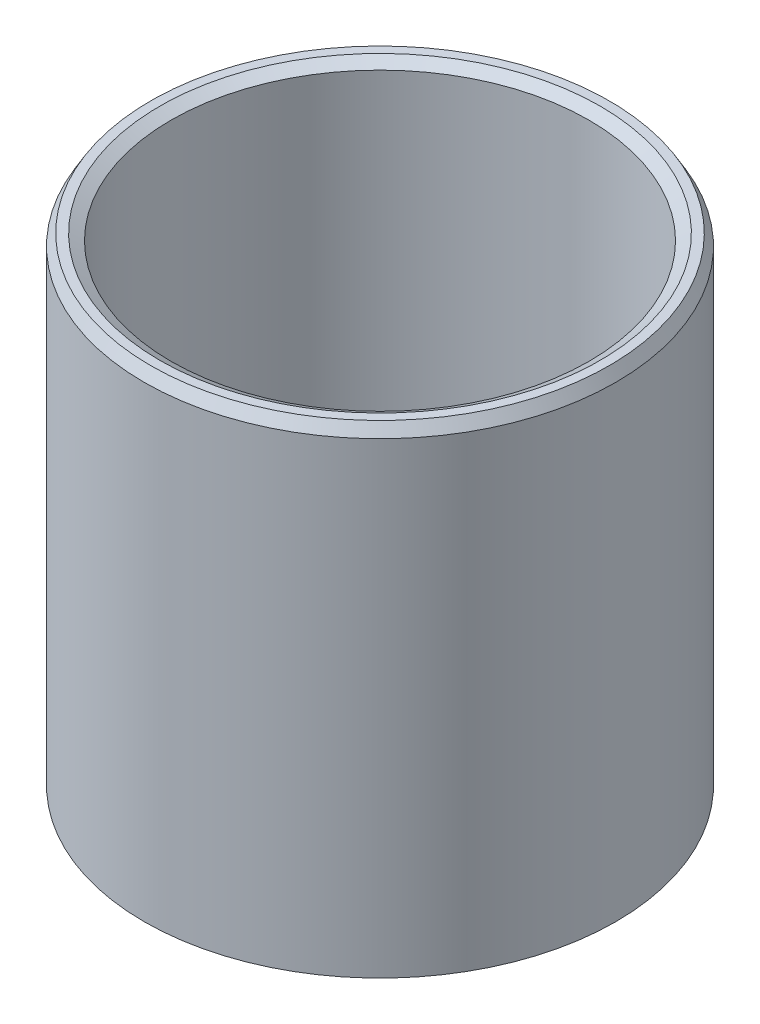
from build123d import *
from OCP.BRepFilletAPI import BRepFilletAPI_MakeChamfer

# Parameters (mm, degrees)
SKETCH1_R           = 42.5
BOSS_EXTRUDE1_DEPTH = 87.382263696
SKETCH2_R           = 37.662144637
CUT_EXTRUDE1_DEPTH  = 107.057343021
CHAMFER1_SIZE       = 2.025331092
CHAMFER1_SIZE2      = 1.169325451


with BuildPart() as part:
    # Sketch1 → Boss-Extrude1 (new body)
    with BuildSketch(Plane(origin=(0, 0, 0), x_dir=(1, 0, 0), z_dir=(0, 1, 0))):
        Circle(SKETCH1_R)
    extrude(amount=BOSS_EXTRUDE1_DEPTH)

    # Sketch2 → Cut-Extrude1 (cut, through all)
    with BuildSketch(Plane(origin=(0, 0, 0), x_dir=(1, 0, 0), z_dir=(0, 1, 0))):
        Circle(SKETCH2_R)
    extrude(amount=CUT_EXTRUDE1_DEPTH, mode=Mode.SUBTRACT)

    # Chamfer1: one chamfer whose edges measure the first distance from different faces: ONE call of the kernel's chamfer builder (chamfer() names one face for all edges)
    chamfer1_edges_1 = [part.edges().sort_by_distance(p)[0] for p in [
        (-37.662144637, 87.382263696, 0),
    ]]
    chamfer1_side_1 = [part.faces().sort_by_distance(p)[0] for p in [
        (-41.297918472, 87.382263696, 0),
    ]]
    chamfer1_edges_2 = [part.edges().sort_by_distance(p)[0] for p in [
        (-37.662144637, 0, 0),
    ]]
    chamfer1_side_2 = [part.faces().sort_by_distance(p)[0] for p in [
        (-37.662144637, 43.691131848, 0),
    ]]
    chamfer1_edges_3 = [part.edges().sort_by_distance(p)[0] for p in [
        (-42.5, 0, 0),
    ]]
    chamfer1_side_3 = [part.faces().sort_by_distance(p)[0] for p in [
        (-41.297918472, 0, 0),
    ]]
    chamfer1_edges_4 = [part.edges().sort_by_distance(p)[0] for p in [
        (-42.5, 87.382263696, 0),
    ]]
    chamfer1_side_4 = [part.faces().sort_by_distance(p)[0] for p in [
        (-42.5, 43.691131848, 0),
    ]]
    chamfer1 = BRepFilletAPI_MakeChamfer(part.part.solid().wrapped)
    for e in chamfer1_edges_1:
        chamfer1.Add(CHAMFER1_SIZE, CHAMFER1_SIZE2, e.wrapped, chamfer1_side_1[0].wrapped)  # the first distance lies on this face
    for e in chamfer1_edges_2:
        chamfer1.Add(CHAMFER1_SIZE, CHAMFER1_SIZE2, e.wrapped, chamfer1_side_2[0].wrapped)  # the first distance lies on this face
    for e in chamfer1_edges_3:
        chamfer1.Add(CHAMFER1_SIZE, CHAMFER1_SIZE2, e.wrapped, chamfer1_side_3[0].wrapped)  # the first distance lies on this face
    for e in chamfer1_edges_4:
        chamfer1.Add(CHAMFER1_SIZE, CHAMFER1_SIZE2, e.wrapped, chamfer1_side_4[0].wrapped)  # the first distance lies on this face
    add(Compound.cast(chamfer1.Shape()), mode=Mode.REPLACE)


solid = part.part
